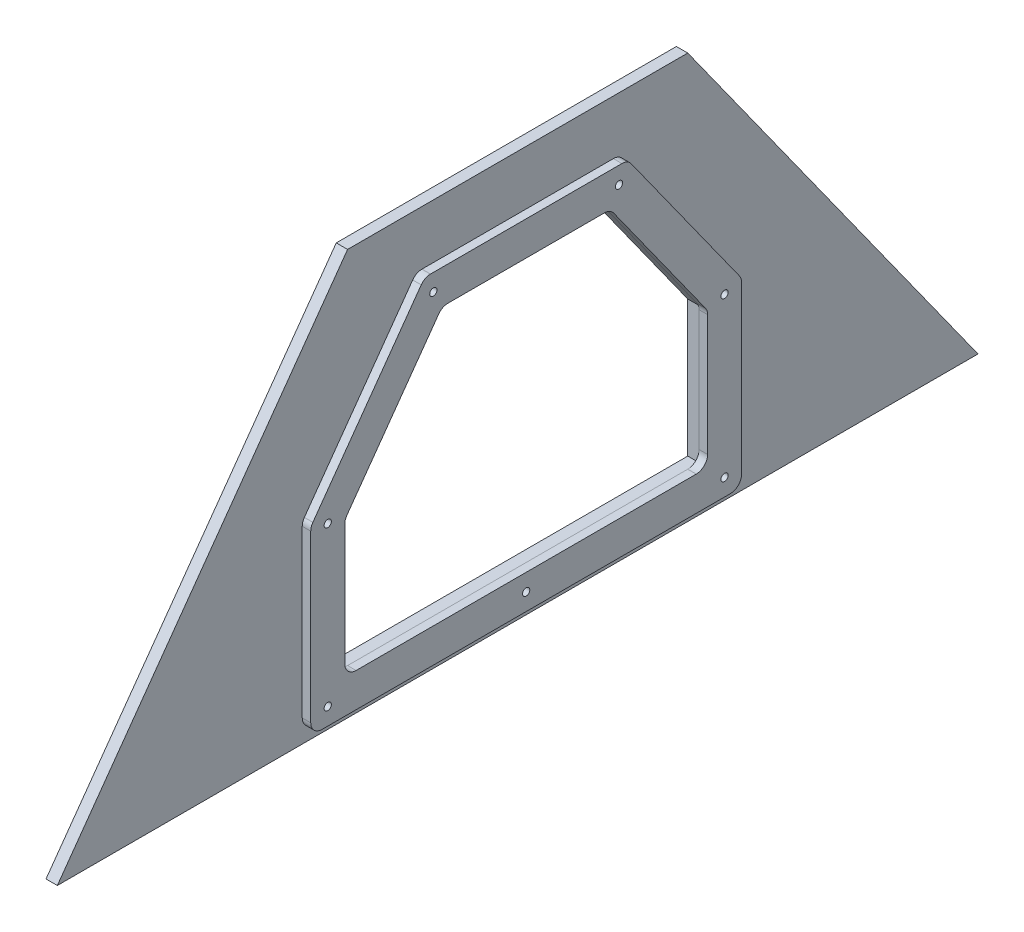
from build123d import *

# Parameters (mm, degrees)
ANGLEDBALLAST_DECKFRONT_OUTLINE_R = 2.5527
ANGLEDBALLAST_DECKFRONT_DEPTH     = 6.35
BOSS_EXTRUDE1_DEPTH               = 4.7625
CUT_EXTRUDE2_DEPTH                = 344.843118524
SKETCH6_W                         = 2.0193
SKETCH6_H                         = 11.1125
F_10_32_TAPPED_HOLE1_AT_2_COUNT   = 2
F_10_32_TAPPED_HOLE1_AT_2_PITCH   = 88.781174089
F_10_32_TAPPED_HOLE1_AT_3_COUNT   = 2
F_10_32_TAPPED_HOLE1_AT_3_PITCH   = 181.362705212
F_10_32_TAPPED_HOLE1_AT_4_COUNT   = 2
F_10_32_TAPPED_HOLE1_AT_4_PITCH   = 236.644368766
F_10_32_TAPPED_HOLE1_AT_5_COUNT   = 2
F_10_32_TAPPED_HOLE1_AT_5_PITCH   = 239.326470272
F_10_32_TAPPED_HOLE1_AT_6_COUNT   = 2
F_10_32_TAPPED_HOLE1_AT_6_PITCH   = 222.25
F_10_32_TAPPED_HOLE1_AT_7_COUNT   = 2
F_10_32_TAPPED_HOLE1_AT_7_PITCH   = 111.125
FILLET1_R                         = 6.35


# Read off the part's stored shape, not the designer's step: AngledBallast_DeckFront
with BuildPart() as part:
    # AngledBallast_DeckFront outline → AngledBallast_DeckFront (new body)
    with BuildSketch(Plane.YZ):
        Polygon((227.241295543, 95.25), (0, 257.81), (0, -257.81), (227.241295543, -95.25), align=None)
        with Locations((15.875, -111.125)):
            Circle(ANGLEDBALLAST_DECKFRONT_OUTLINE_R, mode=Mode.SUBTRACT)
        with Locations((104.656174089, -111.125)):
            Circle(ANGLEDBALLAST_DECKFRONT_OUTLINE_R, mode=Mode.SUBTRACT)
        with Locations((187.325, -51.986786112)):
            Circle(ANGLEDBALLAST_DECKFRONT_OUTLINE_R, mode=Mode.SUBTRACT)
        with Locations((15.875, 0)):
            Circle(ANGLEDBALLAST_DECKFRONT_OUTLINE_R, mode=Mode.SUBTRACT)
        with Locations((15.875, 111.125)):
            Circle(ANGLEDBALLAST_DECKFRONT_OUTLINE_R, mode=Mode.SUBTRACT)
        Polygon((101.6, -101.6), (25.4, -101.6), (25.4, 101.6), (101.6, 101.6), (177.8, 47.089344398), (177.8, -47.089344398), align=None, mode=Mode.SUBTRACT)
        with Locations((104.656174089, 111.125)):
            Circle(ANGLEDBALLAST_DECKFRONT_OUTLINE_R, mode=Mode.SUBTRACT)
        with Locations((187.325, 51.986786112)):
            Circle(ANGLEDBALLAST_DECKFRONT_OUTLINE_R, mode=Mode.SUBTRACT)
    extrude(amount=ANGLEDBALLAST_DECKFRONT_DEPTH)


with BuildPart() as body_2:
    # Sketch1 → Boss-Extrude1 (new body)
    with BuildSketch(Plane(origin=(6.35, 0, 0), x_dir=(0, 0, -1), z_dir=(1, 0, 0))):
        Polygon((120.65, 107.712348179), (56.884227826, 196.85), (-56.884227826, 196.85), (-120.65, 107.712348179), (-120.65, 6.35), (120.65, 6.35), align=None)
    extrude(amount=BOSS_EXTRUDE1_DEPTH)

    # Sketch4 → Cut-Extrude2 (cut, through all)
    with BuildSketch(Plane(origin=(11.1125, 0, 0), x_dir=(0, 0, -1), z_dir=(1, 0, 0))):
        Polygon((-47.089344398, 177.8), (-101.6, 101.6), (-101.6, 25.4), (101.6, 25.4), (101.6, 101.6), (47.089344398, 177.8), align=None)
    extrude(amount=-CUT_EXTRUDE2_DEPTH, mode=Mode.SUBTRACT)

    # Sketch6 → #10-32 Tapped Hole1 (revolve, cut)
    with BuildSketch(Plane(origin=(11.1125, 15.875, 111.125), x_dir=(0, 0, -1), z_dir=(0, 1, 0))):
        with Locations((1.00965, 5.55625)):
            Rectangle(SKETCH6_W, SKETCH6_H)
    f_10_32_tapped_hole1 = revolve(axis=Axis((17.4625, 15.875, 111.125), (-1, 0, 0)), mode=Mode.SUBTRACT)

    # #10-32 Tapped Hole1 at 2: #10-32 Tapped Hole1 ×2
    with Locations(*[(0, i * F_10_32_TAPPED_HOLE1_AT_2_PITCH, 0) for i in range(1, F_10_32_TAPPED_HOLE1_AT_2_COUNT)]):
        add(f_10_32_tapped_hole1, mode=Mode.SUBTRACT)

    # #10-32 Tapped Hole1 at 3: #10-32 Tapped Hole1 ×2
    with Locations(*[Vector(0, 0.9453431994157798, -0.3260770389315034) * (i * F_10_32_TAPPED_HOLE1_AT_3_PITCH) for i in range(1, F_10_32_TAPPED_HOLE1_AT_3_COUNT)]):
        add(f_10_32_tapped_hole1, mode=Mode.SUBTRACT)

    # #10-32 Tapped Hole1 at 4: #10-32 Tapped Hole1 ×2
    with Locations(*[Vector(0, 0.7245048800195719, -0.6892696706136328) * (i * F_10_32_TAPPED_HOLE1_AT_4_PITCH) for i in range(1, F_10_32_TAPPED_HOLE1_AT_4_COUNT)]):
        add(f_10_32_tapped_hole1, mode=Mode.SUBTRACT)

    # #10-32 Tapped Hole1 at 5: #10-32 Tapped Hole1 ×2
    with Locations(*[Vector(0, 0.37096261850402434, -0.928647799584233) * (i * F_10_32_TAPPED_HOLE1_AT_5_PITCH) for i in range(1, F_10_32_TAPPED_HOLE1_AT_5_COUNT)]):
        add(f_10_32_tapped_hole1, mode=Mode.SUBTRACT)

    # #10-32 Tapped Hole1 at 6: #10-32 Tapped Hole1 ×2
    with Locations(*[(0, 0, -i * F_10_32_TAPPED_HOLE1_AT_6_PITCH) for i in range(1, F_10_32_TAPPED_HOLE1_AT_6_COUNT)]):
        add(f_10_32_tapped_hole1, mode=Mode.SUBTRACT)

    # #10-32 Tapped Hole1 at 7: #10-32 Tapped Hole1 ×2
    with Locations(*[(0, 0, -i * F_10_32_TAPPED_HOLE1_AT_7_PITCH) for i in range(1, F_10_32_TAPPED_HOLE1_AT_7_COUNT)]):
        add(f_10_32_tapped_hole1, mode=Mode.SUBTRACT)

    # Fillet1
    fillet1_edges = [body_2.edges().sort_by_distance(p)[0] for p in [
        (8.73125, 196.85, 56.884227826),
        (8.73125, 196.85, -56.884227826),
        (8.73125, 107.712348179, -120.65),
        (8.73125, 6.35, -120.65),
        (8.73125, 6.35, 120.65),
        (8.73125, 107.712348179, 120.65),
        (8.73125, 177.8, 47.089344398),
        (8.73125, 177.8, -47.089344398),
        (8.73125, 101.6, -101.6),
        (8.73125, 25.4, -101.6),
        (8.73125, 25.4, 101.6),
        (8.73125, 101.6, 101.6),
    ]]
    fillet(fillet1_edges, radius=FILLET1_R)


solid = Compound([part.part, body_2.part])
